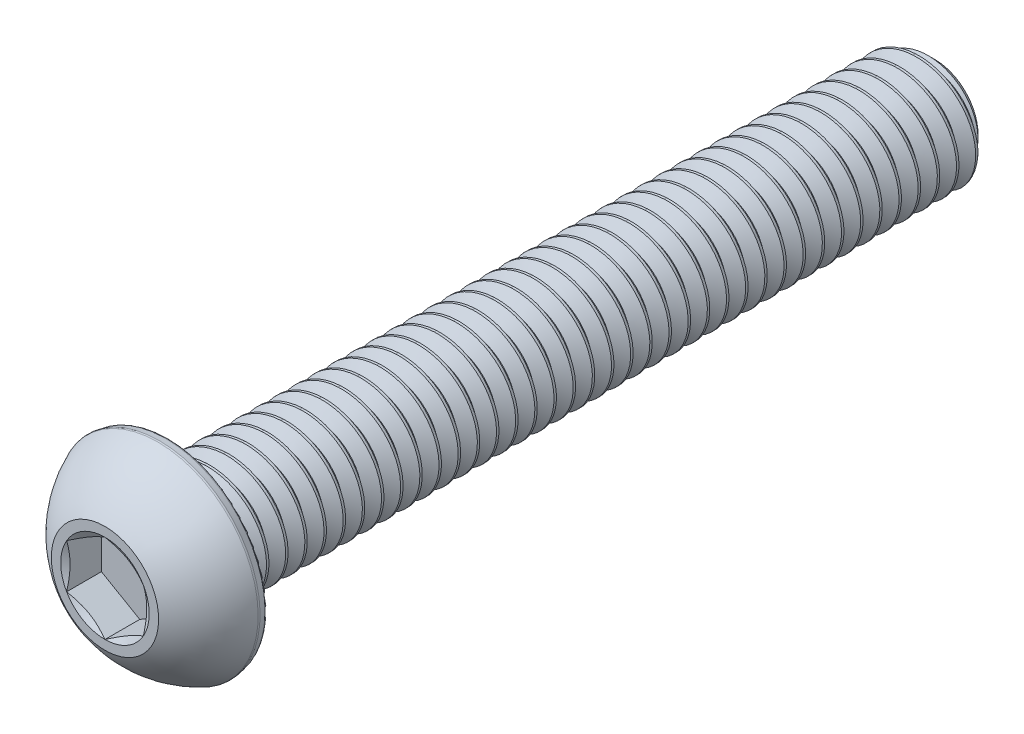
from build123d import *

# Parameters (mm, degrees)
CUT_EXTRUDE1_DEPTH  = 1.815
FILLET1_R           = 0.165
CUT_SWEEP1_PITCH    = 1
CUT_SWEEP1_TO       = 39.55
SKETCH7_R           = 3
BOSS_EXTRUDE1_DEPTH = 2.5
BOSS_EXTRUDE1_DRAFT = -45
FILLET2_R           = 0.165


with BuildPart() as part:
    # Sketch2 → Revolve1 (revolve)
    with BuildSketch(Plane(origin=(0, 0, 0), x_dir=(0, 0, -1), z_dir=(1, 0, 0))):
        with BuildLine():
            Line((40, 0), (-3.3, 0))
            Line((-3.3, 0), (-3.3, 2.8))
            ThreePointArc((-3.3, 2.8), (-2.104811434, 4.262350437), (-0.495, 5.25))
            Line((-0.495, 5.25), (0, 5.162718145))
            Line((0, 5.162718145), (0, 3))
            Line((0, 3), (39.25, 3))
            Line((39.25, 3), (40, 2.25))
            Line((40, 2.25), (40, 0))
        make_face()
    revolve(axis=Axis((0, 0, -40), (0, 0, 1)))

    # Sketch3 → Cut-Extrude1 (cut)
    with BuildSketch(Plane.XY.offset(3.3)):
        Polygon((0, 2.309401077), (-2, 1.154700538), (-2, -1.154700538), (0, -2.309401077), (2, -1.154700538), (2, 1.154700538), align=None)
    extrude(amount=-CUT_EXTRUDE1_DEPTH, mode=Mode.SUBTRACT)

    # Cut-Extrude2 cone 1 section (through the dimple's axis) → Cut-Extrude2 (revolve, cut)
    with BuildSketch(Plane(origin=(0, 0, 3.3), x_dir=(0, -1, 0), z_dir=(1, 0, 0))):
        Polygon((0, 0), (2.309401077, 0), (0, 1.333333333), align=None)
    revolve(axis=Axis((0, 0, 3.3), (0, 0, -1)), mode=Mode.SUBTRACT)

    # Fillet1
    fillet1_edges = [part.edges().sort_by_distance(p)[0] for p in [
        (0, -5.25, 0.495),
        (0, -5.162718145, 0),
    ]]
    fillet(fillet1_edges, radius=FILLET1_R)


with BuildPart() as body_2:
    # Split1: the piece on the far side of the plane
    add(part.part)
    split(bisect_by=Plane.XY.offset(-0.45), keep=Keep.BOTTOM)

    # Cut-Sweep1: arcs per turn and ends read off the stored shape
    # Cut-Sweep1: the profile of Sketch5 screwed along a right-hand helix through 41 turns, 8 arcs to a turn; built about Z, then put on its axis
    cut_sweep1_z = Axis((0, 0, 0), (0, 0, 1))
    cut_sweep1_corners = [(3.054126588, 0, 0.03125), (3.054126588, 0, -0.90625), (2.350480947, 0, -0.5), (2.350480947, 0, -0.375)]
    with BuildLine(mode=Mode.PRIVATE) as cut_sweep1_profile:
        Line(cut_sweep1_corners[0], cut_sweep1_corners[1])
        Line(cut_sweep1_corners[1], cut_sweep1_corners[2])
        Line(cut_sweep1_corners[2], cut_sweep1_corners[3])
        Line(cut_sweep1_corners[3], cut_sweep1_corners[0])
    cut_sweep1_cap = Face(cut_sweep1_profile.wire())
    cut_sweep1_turn_angles = [0, 22.5, 45, 67.5, 90, 112.5, 135, 157.5, 180, 202.5, 225, 247.5, 270, 292.5, 315, 337.5, 360]
    cut_sweep1_turn_weights = [1, 0.9238795325112867, 1, 0.9238795325112867, 1, 0.9238795325112867, 1, 0.9238795325112867, 1, 0.9238795325112867, 1, 0.9238795325112867, 1, 0.9238795325112867, 1, 0.9238795325112867, 1]
    cut_sweep1_turn_rails = [Edge.make_bspline([Vector(p[0], p[1], 0).rotate(cut_sweep1_z, cut_sweep1_turn_angles[k]) / cut_sweep1_turn_weights[k] + Vector(0, 0, p[2] + CUT_SWEEP1_PITCH * cut_sweep1_turn_angles[k] / 360) for k in range(17)], [0, 0, 0, 1, 1, 2, 2, 3, 3, 4, 4, 5, 5, 6, 6, 7, 7, 8, 8, 8], 2, cut_sweep1_turn_weights) for p in cut_sweep1_corners]
    cut_sweep1_turn_sides = [Face.make_surface_from_curves(cut_sweep1_turn_rails[p[0]], cut_sweep1_turn_rails[p[1]]) for p in [(0, 1), (1, 2), (2, 3), (3, 0)]]
    cut_sweep1 = Plane(origin=(0, 0, -40), x_dir=(0, 1, 0), z_dir=(0, 0, 1)) * split(Solid(Shell([*[p.moved(Location((0, 0, CUT_SWEEP1_PITCH * i))) for i in range(41) for p in cut_sweep1_turn_sides], cut_sweep1_cap, cut_sweep1_cap.rotate(cut_sweep1_z, 14760).moved(Location((0, 0, CUT_SWEEP1_PITCH * 14760 / 360)))])), bisect_by=Plane.XY.offset(CUT_SWEEP1_TO), keep=Keep.BOTTOM, mode=Mode.PRIVATE)
    add(cut_sweep1, mode=Mode.SUBTRACT)


with BuildPart() as part_1:
    add(part.part)

    # Split1
    split(bisect_by=Plane.XY.offset(-0.45), keep=Keep.TOP)


with BuildPart() as body_2_1:
    add(body_2.part)

    # Combine1: union part
    add(part_1.part)


with BuildPart() as boss_extrude1_tool:
    # Sketch7 → Boss-Extrude1 (with draft: the straight prism first)
    with BuildSketch(Plane.XY.offset(-0.45)):
        with Locations(Location((0, 0, 0), (0, 0, 90))):
            Circle(SKETCH7_R)
    extrude(amount=-BOSS_EXTRUDE1_DEPTH)
    # Boss-Extrude1: the draft: its side faces are tilted about the plane it starts from
    boss_extrude1_sides = [boss_extrude1_tool.faces().sort_by_distance(p)[0] for p in [
        (0, -3, -1.7),
    ]]
    draft(boss_extrude1_sides, Plane.XY.offset(-0.45), BOSS_EXTRUDE1_DRAFT)


with BuildPart() as body_2_2:
    add(body_2_1.part)

    # Boss-Extrude1: add boss_extrude1_tool
    add(boss_extrude1_tool.part)

    # Fillet2
    fillet2_edges = [body_2_2.edges().sort_by_distance(p)[0] for p in [
        (0, -3, 0),
    ]]
    fillet(fillet2_edges, radius=FILLET2_R)


solid = body_2_2.part
